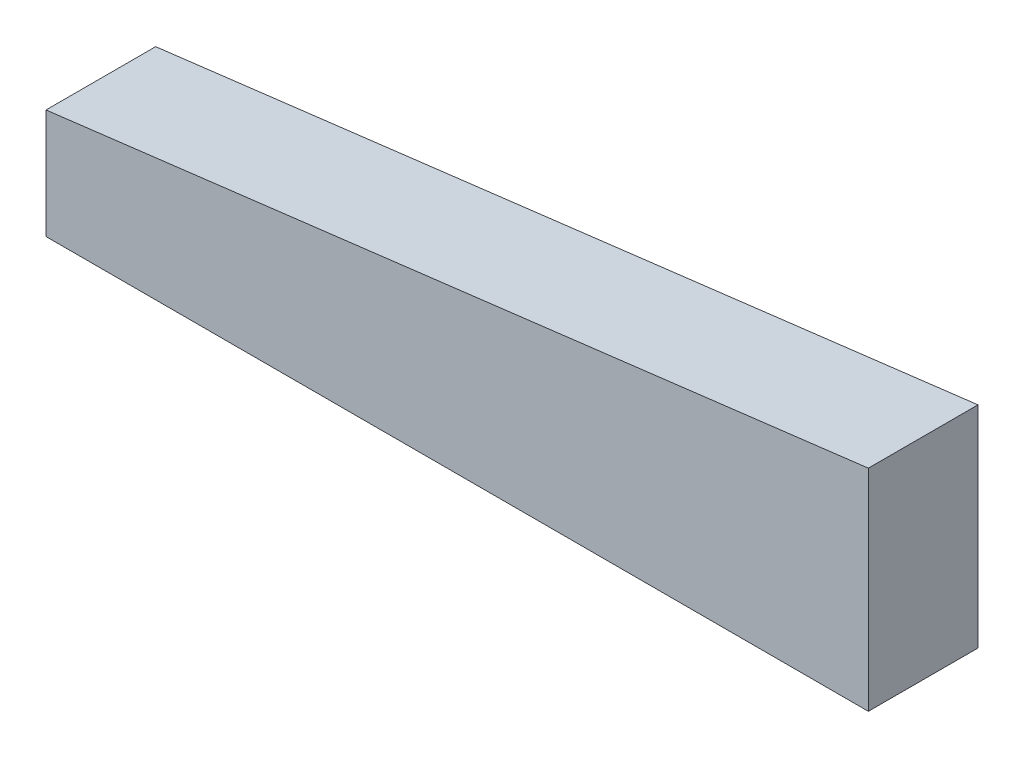
from build123d import *

# Parameters (mm, degrees)
SKETCH1_W           = 150
SKETCH1_H           = 20
BOSS_EXTRUDE1_DEPTH = 10
BOSS_EXTRUDE2_DEPTH = 10


with BuildPart() as part:
    # Sketch1 → Boss-Extrude1 (new, symmetric)
    with BuildSketch(Plane(origin=(0, 0, 0), x_dir=(1, 0, 0), z_dir=(0, 1, 0))):
        Rectangle(SKETCH1_W, SKETCH1_H)
    extrude(amount=BOSS_EXTRUDE1_DEPTH, both=True)

    # Sketch2 → Boss-Extrude2 (add, symmetric)
    with BuildSketch(Plane.XY):
        Polygon((-75, 10), (75, 10), (75, 28.417684135), align=None)
    extrude(amount=BOSS_EXTRUDE2_DEPTH, both=True)


solid = part.part
